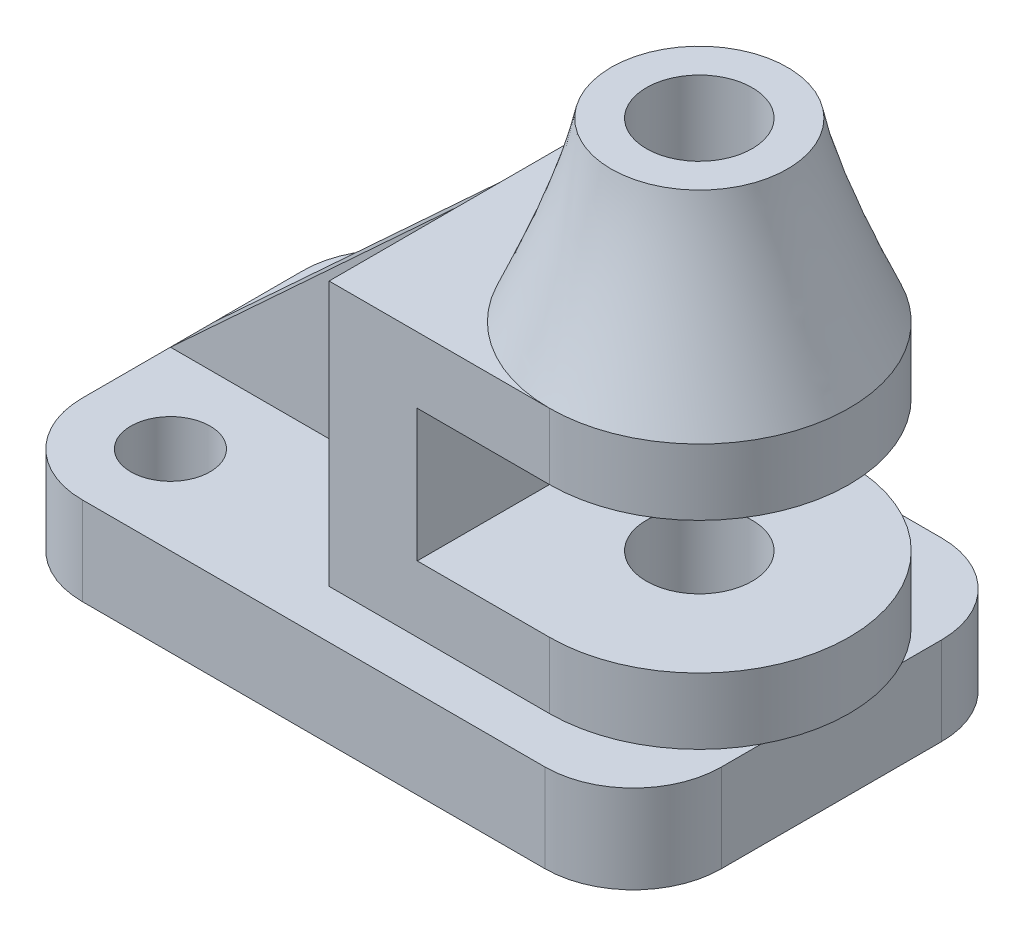
from build123d import *

# Parameters (mm, degrees)
SKETCH1_R           = 9
BOSS_EXTRUDE1_DEPTH = 20
BOSS_EXTRUDE2_DEPTH = 60
SKETCH7_R           = 12
CUT_EXTRUDE1_DEPTH  = 150.255653211
SKETCH8_W           = 103.314171972
SKETCH8_H           = 30
CUT_EXTRUDE2_DEPTH  = 149.637983151
SKETCH10_W          = 10
SKETCH10_H          = 60
BOSS_EXTRUDE3_DEPTH = 65
CUT_EXTRUDE3_DEPTH  = 136.470476619


with BuildPart() as part:
    # Sketch1 → Boss-Extrude1 (new body)
    with BuildSketch(Plane(origin=(0, 0, 0), x_dir=(1, 0, 0), z_dir=(0, 1, 0))):
        with BuildLine():
            Line((-52.5, 45), (52.5, 45))
            ThreePointArc((52.5, 45), (66.642135624, 39.142135624), (72.5, 25))
            Line((72.5, 25), (72.5, -25))
            ThreePointArc((72.5, -25), (66.642135624, -39.142135624), (52.5, -45))
            Line((52.5, -45), (-52.5, -45))
            ThreePointArc((-52.5, -45), (-66.642135624, -39.142135624), (-72.5, -25))
            Line((-72.5, -25), (-72.5, 25))
            ThreePointArc((-72.5, 25), (-66.642135624, 39.142135624), (-52.5, 45))
        make_face()
        with Locations(Location((-52.5, 25, 0), (0, 0, 270))):
            Circle(SKETCH1_R, mode=Mode.SUBTRACT)
        with Locations(Location((-52.5, -25, 0), (0, 0, 270))):
            Circle(SKETCH1_R, mode=Mode.SUBTRACT)
    extrude(amount=-BOSS_EXTRUDE1_DEPTH)

    # Sketch2 → Boss-Extrude2 (add)
    with BuildSketch(Plane(origin=(0, 0, 0), x_dir=(1, 0, 0), z_dir=(0, 1, 0))):
        with BuildLine():
            Line((-7.5, 34), (42.5, 34))
            ThreePointArc((42.5, 34), (76.5, 0), (42.5, -34))
            Line((42.5, -34), (-7.5, -34))
            Line((-7.5, -34), (-7.5, 34))
        make_face()
    extrude(amount=BOSS_EXTRUDE2_DEPTH)

    # Loft1: read off the stored shape, not the designer's step
    # Loft1: loft between two sections, ruled curve by curve
    loft1_from = [
        Edge.make_bspline([(22.989923238, 100, -4.399648251), (31.789219739, 100, -43.419801775), (70.809373263, 100, -34.620505274), (62.010076762, 100, 4.399648251), (53.210780261, 100, 43.419801775), (14.190626737, 100, 34.620505274), (22.989923238, 100, -4.399648251)], [0, 0, 0, 0, 0.5, 0.5, 0.5, 1, 1, 1, 1], 3, [1, 0.333333333, 0.333333333, 1, 0.333333333, 0.333333333, 1]),
    ]
    loft1_to = [
        Edge.make_bspline([(10.620019024, 60, 11.818071457), (-13.01612389, 60, -51.941890495), (50.743838062, 60, -75.578033409), (74.379980976, 60, -11.818071457), (98.01612389, 60, 51.941890495), (34.256161938, 60, 75.578033409), (10.620019024, 60, 11.818071457)], [0, 0, 0, 0, 0.5, 0.5, 0.5, 1, 1, 1, 1], 3, [1, 0.333333333, 0.333333333, 1, 0.333333333, 0.333333333, 1]),
    ]
    loft1 = Solid(Shell([*[Face.make_surface_from_curves(loft1_from[k], loft1_to[k]) for k in range(1)], Face(Wire(loft1_from)), Face(Wire(loft1_to))]))
    add(loft1)

    # Sketch7 → Cut-Extrude1 (cut, through all)
    with BuildSketch(Plane(origin=(0, 100, 0), x_dir=(1, 0, 0), z_dir=(0, 1, 0))):
        with Locations(Location((42.5, 0, 0), (0, 0, 270))):
            Circle(SKETCH7_R)
    extrude(amount=-CUT_EXTRUDE1_DEPTH, mode=Mode.SUBTRACT)

    # Sketch8 → Cut-Extrude2 (cut, through all)
    with BuildSketch(Plane.XY.offset(34)):
        with Locations((64.157085986, 30)):
            Rectangle(SKETCH8_W, SKETCH8_H)
    extrude(amount=-CUT_EXTRUDE2_DEPTH, mode=Mode.SUBTRACT)

    # Sketch10 → Boss-Extrude3 (add, through all)
    with BuildSketch(Plane.ZY.offset(7.5)):
        with Locations((0, 30)):
            Rectangle(SKETCH10_W, SKETCH10_H)
    extrude(amount=BOSS_EXTRUDE3_DEPTH)

    # Sketch11 → Cut-Extrude3 (cut, through all)
    with BuildSketch(Plane.XY.offset(5)):
        Polygon((-7.5, 60), (-72.5, 0), (-72.5, 60), align=None)
    extrude(amount=-CUT_EXTRUDE3_DEPTH, mode=Mode.SUBTRACT)


solid = part.part
